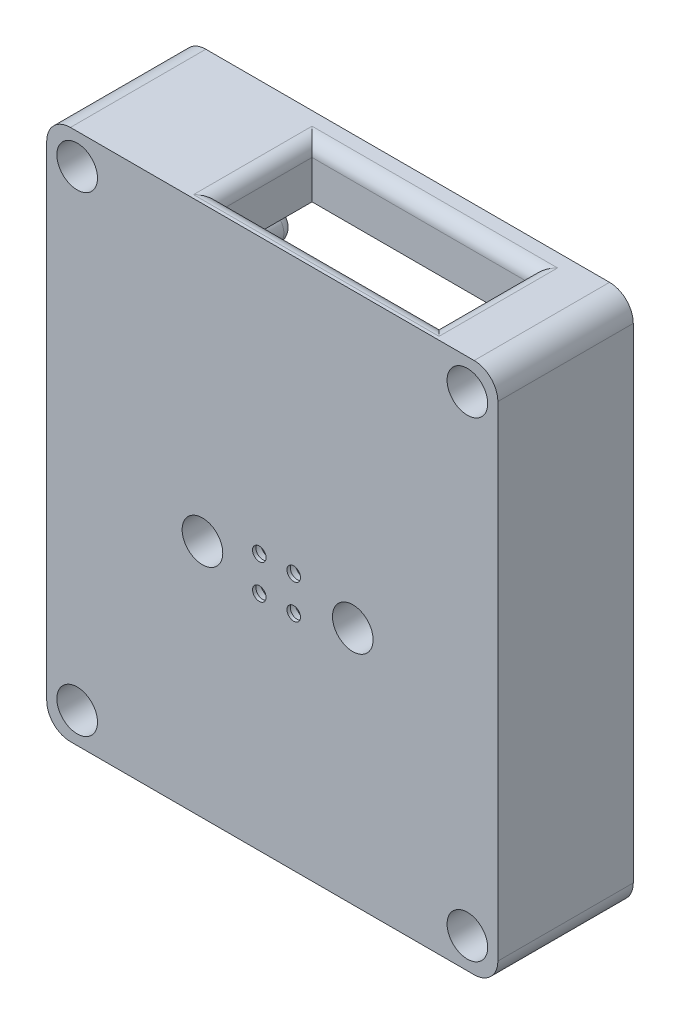
from build123d import *
from OCP.BRepFilletAPI import BRepFilletAPI_MakeChamfer
from build123d.topology import SkipClean

# Parameters (mm, degrees)
SKETCH1_W               = 33.311980516
SKETCH1_H               = 39.280980516
SKETCH1_R               = 1.5
SKETCH1_R_2             = 1
BOSS_EXTRUDE1_DEPTH     = 1.25
BOSS_EXTRUDE3_START     = -4.5
SKETCH1_13_R            = 2
SKETCH1_13_R_2          = 1.125
SKETCH1_13_R_3          = 1.5
BOSS_EXTRUDE3_DEPTH     = 4.5
BOSS_EXTRUDE4_START     = -8.75
SKETCH1_14_W            = 33.311980516
SKETCH1_14_H            = 39.280980516
SKETCH1_14_R            = 1.5
SKETCH1_14_W_2          = 25.63
SKETCH1_14_H_2          = 31.599
BOSS_EXTRUDE4_DEPTH     = 8.75
CHAMFER1_SIZE           = 3
CHAMFER1_SIZE2          = 0.803847577
SKETCH2_W               = 16.13
SKETCH2_H               = 6.75
CUT_EXTRUDE1_DEPTH      = 3.840990258
BOSS_EXTRUDE6_START     = -1.25
BOSS_EXTRUDE6_OUTLINE_R = 1
BOSS_EXTRUDE6_DEPTH     = 1.25
FILLET1_R               = 1.75
FILLET4_R               = 1
FILLET5_R               = 0.25
FILLET6_R               = 1
SKETCH1_18_R            = 1.125
BOSS_EXTRUDE7_DEPTH     = 8.25
FILLET7_R               = 0.75
BOSS_EXTRUDE8_START     = 0.25
SKETCH6_R               = 1
SKETCH6_R_2             = 0.5
BOSS_EXTRUDE8_DEPTH     = 0.25
SKETCH4_R               = 1
SKETCH4_R_2             = 0.5
BOSS_EXTRUDE9_DEPTH     = 0.25
SKETCH3_R               = 1
SKETCH3_R_2             = 0.5
BOSS_EXTRUDE10_DEPTH    = 0.25


# Read off the part's stored shape, not the designer's step: Boss-Extrude6
with BuildPart() as part:
    # Sketch1 → Boss-Extrude1 (new body)
    with BuildSketch(Plane.XY):
        with Locations((12.065, 15.0495)):
            Rectangle(SKETCH1_W, SKETCH1_H)
        with Locations((6.908038, 13.09497)):
            Circle(SKETCH1_R, mode=Mode.SUBTRACT)
        with Locations((18.008092, 13.09497)):
            Circle(SKETCH1_R, mode=Mode.SUBTRACT)
        with Locations((-2.340990258, -2.340990258)):
            Circle(SKETCH1_R, mode=Mode.SUBTRACT)
        with Locations((26.470990258, -2.340990258)):
            Circle(SKETCH1_R, mode=Mode.SUBTRACT)
        with Locations((-2.340990258, 32.439990258)):
            Circle(SKETCH1_R, mode=Mode.SUBTRACT)
        with Locations((26.470990258, 32.439990258)):
            Circle(SKETCH1_R, mode=Mode.SUBTRACT)
        with Locations((11.107928, 14.394942)):
            Circle(SKETCH1_R_2, mode=Mode.SUBTRACT)
        with Locations((13.647928, 14.394942)):
            Circle(SKETCH1_R_2, mode=Mode.SUBTRACT)
        with Locations((11.107928, 11.854942)):
            Circle(SKETCH1_R_2, mode=Mode.SUBTRACT)
        with Locations((13.647928, 11.854942)):
            Circle(SKETCH1_R_2, mode=Mode.SUBTRACT)
    extrude(amount=BOSS_EXTRUDE1_DEPTH)

    # Sketch1<13> → Boss-Extrude3 (add)
    # profile 1 of 8: a face of its own
    with BuildSketch(Plane.XY.offset(BOSS_EXTRUDE3_START)):
        with Locations((3.048, 27.051)):
            Circle(SKETCH1_13_R)
        with Locations((3.048, 27.051)):
            Circle(SKETCH1_13_R_2, mode=Mode.SUBTRACT)
    # profile 2 of 8: a face of its own
    with BuildSketch(Plane.XY.offset(BOSS_EXTRUDE3_START)):
        with Locations((6.908038, 13.09497)):
            Circle(SKETCH1_13_R)
        with Locations((6.908038, 13.09497)):
            Circle(SKETCH1_13_R_3, mode=Mode.SUBTRACT)
    # profile 3 of 8: a face of its own
    with BuildSketch(Plane.XY.offset(BOSS_EXTRUDE3_START)):
        with Locations((18.008092, 13.09497)):
            Circle(SKETCH1_13_R)
        with Locations((18.008092, 13.09497)):
            Circle(SKETCH1_13_R_3, mode=Mode.SUBTRACT)
    # profile 4 of 8: a face of its own
    with BuildSketch(Plane.XY.offset(BOSS_EXTRUDE3_START)):
        with Locations((21.336, 2.921)):
            Circle(SKETCH1_13_R)
        with Locations((21.336, 2.921)):
            Circle(SKETCH1_13_R_2, mode=Mode.SUBTRACT)
    # profile 5 of 8: a face of its own
    with BuildSketch(Plane.XY.offset(BOSS_EXTRUDE3_START)):
        with Locations((3.048, 2.921)):
            Circle(SKETCH1_13_R)
        with Locations((3.048, 2.921)):
            Circle(SKETCH1_13_R_2, mode=Mode.SUBTRACT)
    # profile 6 of 8: a face of its own
    with BuildSketch(Plane.XY.offset(BOSS_EXTRUDE3_START)):
        with Locations((3.048, 2.921)):
            Circle(SKETCH1_13_R_2)
    # profile 7 of 8: a face of its own
    with BuildSketch(Plane.XY.offset(BOSS_EXTRUDE3_START)):
        with Locations((21.336, 2.921)):
            Circle(SKETCH1_13_R_2)
    # profile 8 of 8: a face of its own
    with BuildSketch(Plane.XY.offset(BOSS_EXTRUDE3_START)):
        with Locations((3.048, 27.051)):
            Circle(SKETCH1_13_R_2)
    extrude(amount=BOSS_EXTRUDE3_DEPTH)

    # Sketch1<14> → Boss-Extrude4 (add)
    with SkipClean():  # the faces are left unmerged after this step: merging them gives an invalid solid
        with BuildSketch(Plane.XY.offset(BOSS_EXTRUDE4_START)):
            with Locations((12.065, 15.0495)):
                Rectangle(SKETCH1_14_W, SKETCH1_14_H)
            with BuildLine():
                ThreePointArc((-0.840990258, -2.340990258), (-3.726809556, -2.915015406), (-1.280330086, -1.280330086))
                ThreePointArc((-1.280330086, -1.280330086), (-0.955170959, -1.766965109), (-0.840990258, -2.340990258))
            make_face(mode=Mode.SUBTRACT)
            with Locations((26.470990258, -2.340990258)):
                Circle(SKETCH1_14_R, mode=Mode.SUBTRACT)
            with Locations((-2.340990258, 32.439990258)):
                Circle(SKETCH1_14_R, mode=Mode.SUBTRACT)
            with Locations((12.065, 15.0495)):
                Rectangle(SKETCH1_14_W_2, SKETCH1_14_H_2, mode=Mode.SUBTRACT)
            with Locations((26.470990258, 32.439990258)):
                Circle(SKETCH1_14_R, mode=Mode.SUBTRACT)
        extrude(amount=BOSS_EXTRUDE4_DEPTH)

    # Chamfer1: one chamfer whose edges measure the first distance from different faces: ONE call of the kernel's chamfer builder (chamfer() names one face for all edges)
    chamfer1_edges_1 = [part.edges().sort_by_distance(p)[0] for p in [
        (4.908038, 13.09497, 0),
    ]]
    chamfer1_side_1 = [part.faces().sort_by_distance(p)[0] for p in [
        (4.908038, 13.09497, -2.25),
    ]]
    chamfer1_edges_2 = [part.edges().sort_by_distance(p)[0] for p in [
        (16.008092, 13.09497, 0),
    ]]
    chamfer1_side_2 = [part.faces().sort_by_distance(p)[0] for p in [
        (16.008092, 13.09497, -2.25),
    ]]
    chamfer1_edges_3 = [part.edges().sort_by_distance(p)[0] for p in [
        (1.048, 2.921, 0),
    ]]
    chamfer1_side_3 = [part.faces().sort_by_distance(p)[0] for p in [
        (1.048, 2.921, -2.25),
    ]]
    chamfer1_edges_4 = [part.edges().sort_by_distance(p)[0] for p in [
        (19.336, 2.921, 0),
    ]]
    chamfer1_side_4 = [part.faces().sort_by_distance(p)[0] for p in [
        (19.336, 2.921, -2.25),
    ]]
    chamfer1_edges_5 = [part.edges().sort_by_distance(p)[0] for p in [
        (1.048, 27.051, 0),
    ]]
    chamfer1_side_5 = [part.faces().sort_by_distance(p)[0] for p in [
        (1.048, 27.051, -2.25),
    ]]
    chamfer1 = BRepFilletAPI_MakeChamfer(part.part.solid().wrapped)
    for e in chamfer1_edges_1:
        chamfer1.Add(CHAMFER1_SIZE, CHAMFER1_SIZE2, e.wrapped, chamfer1_side_1[0].wrapped)  # the first distance lies on this face
    for e in chamfer1_edges_2:
        chamfer1.Add(CHAMFER1_SIZE, CHAMFER1_SIZE2, e.wrapped, chamfer1_side_2[0].wrapped)  # the first distance lies on this face
    for e in chamfer1_edges_3:
        chamfer1.Add(CHAMFER1_SIZE, CHAMFER1_SIZE2, e.wrapped, chamfer1_side_3[0].wrapped)  # the first distance lies on this face
    for e in chamfer1_edges_4:
        chamfer1.Add(CHAMFER1_SIZE, CHAMFER1_SIZE2, e.wrapped, chamfer1_side_4[0].wrapped)  # the first distance lies on this face
    for e in chamfer1_edges_5:
        chamfer1.Add(CHAMFER1_SIZE, CHAMFER1_SIZE2, e.wrapped, chamfer1_side_5[0].wrapped)  # the first distance lies on this face
    add(Compound.cast(chamfer1.Shape()), mode=Mode.REPLACE)

    # Sketch2 → Cut-Extrude1 (cut)
    with SkipClean():  # the faces are left unmerged after this step: merging them gives an invalid solid
        with BuildSketch(Plane.XZ.offset(-30.849)):
            with Locations((15.065, -3.375)):
                Rectangle(SKETCH2_W, SKETCH2_H)
        extrude(amount=-CUT_EXTRUDE1_DEPTH, mode=Mode.SUBTRACT)

    # Boss-Extrude6 outline → Boss-Extrude6 (add)
    with SkipClean():  # the faces are left unmerged after this step: merging them gives an invalid solid
        with BuildSketch(Plane.XY.offset(BOSS_EXTRUDE6_START)):
            with BuildLine():
                ThreePointArc((8.804037095, 13.731513347), (8.908007976, 13.10592874), (8.810898854, 12.479242324))
                ThreePointArc((8.810898854, 12.479242324), (8.89166235, 12.131676268), (9.006205703, 11.79373437))
                ThreePointArc((9.006205703, 11.79373437), (12.469490782, 9.501098563), (15.812575655, 11.965709285))
                ThreePointArc((15.812575655, 11.965709285), (16.002876636, 13.105644701), (15.824722917, 14.247541573))
                ThreePointArc((15.824722917, 14.247541573), (12.468925537, 16.748799675), (8.991820026, 14.419120423))
                ThreePointArc((8.991820026, 14.419120423), (8.880986912, 14.079943586), (8.804037095, 13.731513347))
            make_face()
            with Locations((13.647928, 14.394942)):
                Circle(BOSS_EXTRUDE6_OUTLINE_R, mode=Mode.SUBTRACT)
            with Locations((11.107928, 11.854942)):
                Circle(BOSS_EXTRUDE6_OUTLINE_R, mode=Mode.SUBTRACT)
            with Locations((11.107928, 14.394942)):
                Circle(BOSS_EXTRUDE6_OUTLINE_R, mode=Mode.SUBTRACT)
            with Locations((13.647928, 11.854942)):
                Circle(BOSS_EXTRUDE6_OUTLINE_R, mode=Mode.SUBTRACT)
        extrude(amount=BOSS_EXTRUDE6_DEPTH)

    # Fillet1
    fillet1_edges = [part.edges().sort_by_distance(p)[0] for p in [
        (-4.590990258, -4.590990258, -4.375),
        (-4.590990258, 34.689990258, -4.375),
        (28.720990258, 34.689990258, -4.375),
        (28.720990258, -4.590990258, -4.375),
    ]]
    fillet(fillet1_edges, radius=FILLET1_R)

    # Fillet4
    # the kernel refuses this fillet: 1 mm, written as the material it adds along each edge
    with BuildSketch(Plane(origin=(23.13, 30.849, 0), x_dir=(0, 0, -1), z_dir=(1, 0, 0))) as fillet4_piece_1:
        with BuildLine():
            CenterArc((FILLET4_R, -FILLET4_R), FILLET4_R, 90, 90)
            Line((0, -FILLET4_R), (0, 0))
            Line((0, 0), (FILLET4_R, 0))
        make_face()
    extrude(amount=4.25)
    with BuildSketch(Plane(origin=(27.38, -0.75, 0), x_dir=(0, 0, -1), z_dir=(-1, 0, 0))) as fillet4_piece_2:
        with BuildLine():
            CenterArc((FILLET4_R, -FILLET4_R), FILLET4_R, 90, 90)
            Line((0, -FILLET4_R), (0, 0))
            Line((0, 0), (FILLET4_R, 0))
        make_face()
    extrude(amount=30.63)
    with BuildSketch(Plane(origin=(24.88, 33.349, 0), x_dir=(0, 0, -1), z_dir=(0, -1, 0)), Plane(origin=(-0.75, -3.25, 0), x_dir=(0, 0, -1), z_dir=(0, 1, 0))) as fillet4_piece_3:
        with BuildLine():
            CenterArc((FILLET4_R, -FILLET4_R), FILLET4_R, 90, 90)
            Line((0, -FILLET4_R), (0, 0))
            Line((0, 0), (FILLET4_R, 0))
        make_face()
    extrude(amount=36.599)
    with BuildSketch(Plane(origin=(-3.25, 30.849, 0), x_dir=(0, 0, -1), z_dir=(1, 0, 0))) as fillet4_piece_4:
        with BuildLine():
            CenterArc((FILLET4_R, -FILLET4_R), FILLET4_R, 90, 90)
            Line((0, -FILLET4_R), (0, 0))
            Line((0, 0), (FILLET4_R, 0))
        make_face()
    extrude(amount=10.25)

    # Fillet5
    fillet5_edges = [part.edges().sort_by_distance(p)[0] for p in [
        (0.838434618, 1.194911341, 0),
        (3.138542022, 5.723385302, 0),
        (5.312152003, 1.267162963, 0),
        (19.233549299, 4.776063958, 0),
        (23.191063958, 0.818549299, 0),
        (4.104232514, 13.079606682, 0),
        (18.816137289, 15.779858089, 0),
        (18.801833125, 10.405818412, 0),
        (12.452734425, 16.749170056, 0),
        (5.093608528, 28.968562773, 0),
        (3.138542022, 24.248614698, 0),
        (1.065380365, 29.033619635, 0),
    ]]
    fillet(fillet5_edges, radius=FILLET5_R)

    # Fillet6
    fillet6_edges = [part.edges().sort_by_distance(p)[0] for p in [
        (15.065, 34.689990258, 0),
        (7, 34.689990258, -3.375),
        (15.065, 34.689990258, -6.75),
        (23.13, 34.689990258, -3.375),
    ]]
    fillet(fillet6_edges, radius=FILLET6_R)

    # Sketch1<18> → Boss-Extrude7 (add)
    with BuildSketch(Plane.XY):
        with Locations((3.048, 2.921)):
            Circle(SKETCH1_18_R)
        with Locations((21.336, 2.921)):
            Circle(SKETCH1_18_R)
        with Locations((3.048, 27.051)):
            Circle(SKETCH1_18_R)
    extrude(amount=-BOSS_EXTRUDE7_DEPTH)

    # Fillet7
    fillet7_edges = [part.edges().sort_by_distance(p)[0] for p in [
        (1.923, 2.921, -8.25),
        (20.211, 2.921, -8.25),
        (1.923, 27.051, -8.25),
    ]]
    fillet(fillet7_edges, radius=FILLET7_R)

    # Sketch6 → Boss-Extrude8 (add)
    # profile 1 of 4: a face of its own
    with BuildSketch(Plane(origin=(0, 0, 1.25), x_dir=(-1, 0, 0), z_dir=(0, 0, -1)).offset(BOSS_EXTRUDE8_START)):
        with Locations((-13.647928, 14.394942)):
            Circle(SKETCH6_R)
        with Locations((-13.647928, 14.394942)):
            Circle(SKETCH6_R_2, mode=Mode.SUBTRACT)
    # profile 2 of 4: a face of its own
    with BuildSketch(Plane(origin=(0, 0, 1.25), x_dir=(-1, 0, 0), z_dir=(0, 0, -1)).offset(BOSS_EXTRUDE8_START)):
        with Locations((-13.647928, 11.854942)):
            Circle(SKETCH6_R)
        with Locations((-13.647928, 11.854942)):
            Circle(SKETCH6_R_2, mode=Mode.SUBTRACT)
    # profile 3 of 4: a face of its own
    with BuildSketch(Plane(origin=(0, 0, 1.25), x_dir=(-1, 0, 0), z_dir=(0, 0, -1)).offset(BOSS_EXTRUDE8_START)):
        with Locations((-11.107928, 11.854942)):
            Circle(SKETCH6_R)
        with Locations((-11.107928, 11.854942)):
            Circle(SKETCH6_R_2, mode=Mode.SUBTRACT)
    # profile 4 of 4: a face of its own
    with BuildSketch(Plane(origin=(0, 0, 1.25), x_dir=(-1, 0, 0), z_dir=(0, 0, -1)).offset(BOSS_EXTRUDE8_START)):
        with Locations((-11.107928, 14.394942)):
            Circle(SKETCH6_R)
        with Locations((-11.107928, 14.394942)):
            Circle(SKETCH6_R_2, mode=Mode.SUBTRACT)
    extrude(amount=-BOSS_EXTRUDE8_DEPTH)

    # Sketch4 → Boss-Extrude9 (add)
    # profile 1 of 4: a face of its own
    with BuildSketch(Plane.XY):
        with Locations((11.107928, 14.394942)):
            Circle(SKETCH4_R)
        with Locations(Location((11.107928, 14.394942, 0), (0, 0, 180))):
            Circle(SKETCH4_R_2, mode=Mode.SUBTRACT)
    # profile 2 of 4: a face of its own
    with BuildSketch(Plane.XY):
        with Locations((11.107928, 11.854942)):
            Circle(SKETCH4_R)
        with Locations(Location((11.107928, 11.854942, 0), (0, 0, 180))):
            Circle(SKETCH4_R_2, mode=Mode.SUBTRACT)
    # profile 3 of 4: a face of its own
    with BuildSketch(Plane.XY):
        with Locations((13.647928, 11.854942)):
            Circle(SKETCH4_R)
        with Locations(Location((13.647928, 11.854942, 0), (0, 0, 180))):
            Circle(SKETCH4_R_2, mode=Mode.SUBTRACT)
    # profile 4 of 4: a face of its own
    with BuildSketch(Plane.XY):
        with Locations((13.647928, 14.394942)):
            Circle(SKETCH4_R)
        with Locations(Location((13.647928, 14.394942, 0), (0, 0, 180))):
            Circle(SKETCH4_R_2, mode=Mode.SUBTRACT)
    extrude(amount=BOSS_EXTRUDE9_DEPTH)

    # Sketch3 → Boss-Extrude10 (add)
    # profile 1 of 4: a face of its own
    with BuildSketch(Plane.XY.offset(-1.25)):
        with Locations((11.107928, 14.394942)):
            Circle(SKETCH3_R)
        with Locations(Location((11.107928, 14.394942, 0), (0, 0, 180))):
            Circle(SKETCH3_R_2, mode=Mode.SUBTRACT)
    # profile 2 of 4: a face of its own
    with BuildSketch(Plane.XY.offset(-1.25)):
        with Locations((11.107928, 11.854942)):
            Circle(SKETCH3_R)
        with Locations(Location((11.107928, 11.854942, 0), (0, 0, 180))):
            Circle(SKETCH3_R_2, mode=Mode.SUBTRACT)
    # profile 3 of 4: a face of its own
    with BuildSketch(Plane.XY.offset(-1.25)):
        with Locations((13.647928, 11.854942)):
            Circle(SKETCH3_R)
        with Locations(Location((13.647928, 11.854942, 0), (0, 0, 180))):
            Circle(SKETCH3_R_2, mode=Mode.SUBTRACT)
    # profile 4 of 4: a face of its own
    with BuildSketch(Plane.XY.offset(-1.25)):
        with Locations((13.647928, 14.394942)):
            Circle(SKETCH3_R)
        with Locations(Location((13.647928, 14.394942, 0), (0, 0, 180))):
            Circle(SKETCH3_R_2, mode=Mode.SUBTRACT)
    extrude(amount=BOSS_EXTRUDE10_DEPTH)


solid = part.part
